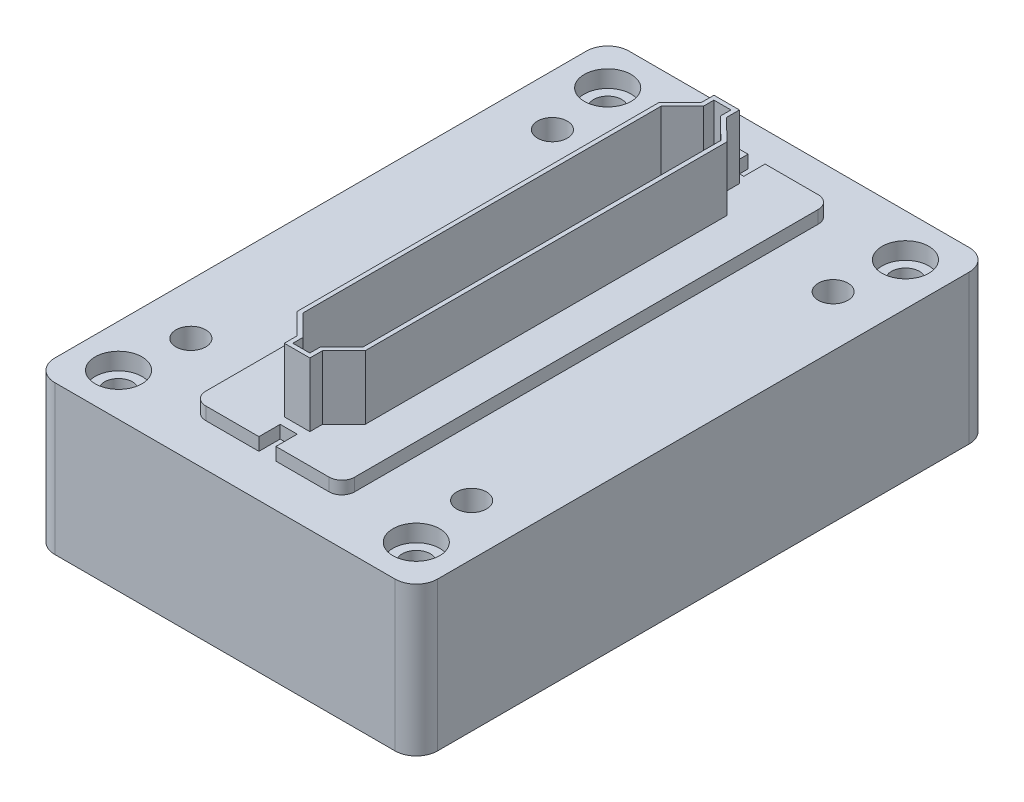
from build123d import *

# Parameters (mm, degrees)
SKETCH2_W               = 90
SKETCH2_H               = 135
BOSS_EXTRUDE1_DEPTH     = 35
FILLET1_R               = 5
SKETCH8_R               = 3.5
CUT_EXTRUDE1_DEPTH      = 10
MIRROR2_COPY_2_SKETCH_R = 3.5
MIRROR2_COPY_2_DEPTH    = 10
MIRROR2_COPY_4_SKETCH_R = 3.5
MIRROR2_COPY_4_DEPTH    = 10
BOSS_EXTRUDE2_DEPTH     = 3
BOSS_EXTRUDE3_DEPTH     = 15


with BuildPart() as part:
    # Sketch2 → Boss-Extrude1 (new body)
    with BuildSketch(Plane(origin=(0, 0, 0), x_dir=(1, 0, 0), z_dir=(0, 1, 0))):
        Rectangle(SKETCH2_W, SKETCH2_H)
    extrude(amount=BOSS_EXTRUDE1_DEPTH)

    # Fillet1
    fillet1_edges = [part.edges().sort_by_distance(p)[0] for p in [
        (45, 17.5, -67.5),
        (45, 17.5, 67.5),
        (-45, 17.5, 67.5),
        (-45, 17.5, -67.5),
    ]]
    fillet(fillet1_edges, radius=FILLET1_R)

    # Sketch6 → CBORE for M6 Hex Head Bolt1 (revolve, cut)
    with BuildSketch(Plane(origin=(-35, 35, -57.5), x_dir=(0, 0, 1), z_dir=(1, 0, 0))):
        Polygon((0, 0), (0, 43.982840043), (3.3, 42), (3.3, 4), (5.5, 4), (5.5, 0), align=None)
    cbore_for_m6_hex_head_bolt1 = revolve(axis=Axis((-35, 41.35, -57.5), (0, -1, 0)), mode=Mode.SUBTRACT)

    # Sketch8 → Cut-Extrude1 (cut)
    with BuildSketch(Plane(origin=(0, 35, 0), x_dir=(1, 0, 0), z_dir=(0, 1, 0))):
        with Locations((-33, 42.5)):
            Circle(SKETCH8_R)
    cut_extrude1 = extrude(amount=-CUT_EXTRUDE1_DEPTH, mode=Mode.SUBTRACT)

    # Mirror1: CBORE for M6 Hex Head Bolt1, Cut-Extrude1 across plane
    add(cbore_for_m6_hex_head_bolt1.mirror(Plane(origin=(0, 0, 0), x_dir=(0, 0, 1), z_dir=(1, 0, 0))), mode=Mode.SUBTRACT)
    add(cut_extrude1.mirror(Plane(origin=(0, 0, 0), x_dir=(0, 0, 1), z_dir=(1, 0, 0))), mode=Mode.SUBTRACT)

    # Mirror2 copy 1 sketch → Mirror2 copy 1 (revolve, cut)
    with BuildSketch(Plane(origin=(35, 35, 57.5), x_dir=(0, 0, -1), z_dir=(-1, 0, 0))):
        Polygon((0, 0), (0, 43.982840043), (3.3, 42), (3.3, 4), (5.5, 4), (5.5, 0), align=None)
    revolve(axis=Axis((35, 41.35, 57.5), (0, -1, 0)), mode=Mode.SUBTRACT)

    # Mirror2 copy 2 sketch → Mirror2 copy 2 (cut)
    with BuildSketch(Plane(origin=(0, 35, 0), x_dir=(-1, 0, 0), z_dir=(0, 1, 0))):
        with Locations((-33, 42.5)):
            Circle(MIRROR2_COPY_2_SKETCH_R)
    extrude(amount=-MIRROR2_COPY_2_DEPTH, mode=Mode.SUBTRACT)

    # Mirror2 copy 3 sketch → Mirror2 copy 3 (revolve, cut)
    with BuildSketch(Plane(origin=(-35, 35, 57.5), x_dir=(0, 0, -1), z_dir=(1, 0, 0))):
        Polygon((0, 0), (0, -43.982840043), (3.3, -42), (3.3, -4), (5.5, -4), (5.5, 0), align=None)
    revolve(axis=Axis((-35, 41.35, 57.5), (0, 1, 0)), mode=Mode.SUBTRACT)

    # Mirror2 copy 4 sketch → Mirror2 copy 4 (cut)
    with BuildSketch(Plane(origin=(0, 35, 0), x_dir=(1, 0, 0), z_dir=(0, 1, 0))):
        with Locations((-33, -42.5)):
            Circle(MIRROR2_COPY_4_SKETCH_R)
    extrude(amount=-MIRROR2_COPY_4_DEPTH, mode=Mode.SUBTRACT)


with BuildPart() as body_2:
    # Sketch9 → Boss-Extrude2 (new body)
    with BuildSketch(Plane(origin=(0, 35, 0), x_dir=(1, 0, 0), z_dir=(0, 1, 0))):
        with BuildLine():
            Line((14.5, -57.5), (2, -57.5))
            Line((2, -57.5), (2, -52.5))
            Line((2, -52.5), (-2, -52.5))
            Line((-2, -52.5), (-2, -57.5))
            Line((-2, -57.5), (-14.5, -57.5))
            ThreePointArc((-14.5, -57.5), (-16.621320344, -56.621320344), (-17.5, -54.5))
            Line((-17.5, -54.5), (-17.5, 54.5))
            ThreePointArc((-17.5, 54.5), (-16.621320344, 56.621320344), (-14.5, 57.5))
            Line((-14.5, 57.5), (-2, 57.5))
            Line((-2, 57.5), (-2, 52.5))
            Line((-2, 52.5), (2, 52.5))
            Line((2, 52.5), (2, 57.5))
            Line((2, 57.5), (14.5, 57.5))
            ThreePointArc((14.5, 57.5), (16.621320344, 56.621320344), (17.5, 54.5))
            Line((17.5, 54.5), (17.5, -54.5))
            ThreePointArc((17.5, -54.5), (16.621320344, -56.621320344), (14.5, -57.5))
        make_face()
    extrude(amount=BOSS_EXTRUDE2_DEPTH)

    # Sketch10 → Boss-Extrude3 (add)
    with BuildSketch(Plane(origin=(0, 38, 0), x_dir=(1, 0, 0), z_dir=(0, 1, 0))):
        Polygon((2.975253238, 47.5), (8, 42.5), (8, -42.5), (2.975253238, -47.5), (2.975253238, -50.5), (-3.024746762, -50.5), (-3.024746762, -47.5), (-8, -42.5), (-8, 42.5), (-3.024746762, 47.5), (-3.024746762, 50.5), (2.975253238, 50.5), align=None)
        Polygon((7, -42.084339647), (7, 42.084339647), (1.975253238, 47.084339647), (1.975253238, 49.5), (-2.024746762, 49.5), (-2.024746762, 47.087238917), (-7, 42.087238917), (-7, -42.087238917), (-2.024746762, -47.087238917), (-2.024746762, -49.5), (1.975253238, -49.5), (1.975253238, -47.084339647), align=None, mode=Mode.SUBTRACT)
    extrude(amount=BOSS_EXTRUDE3_DEPTH)


solid = Compound([part.part, body_2.part])
